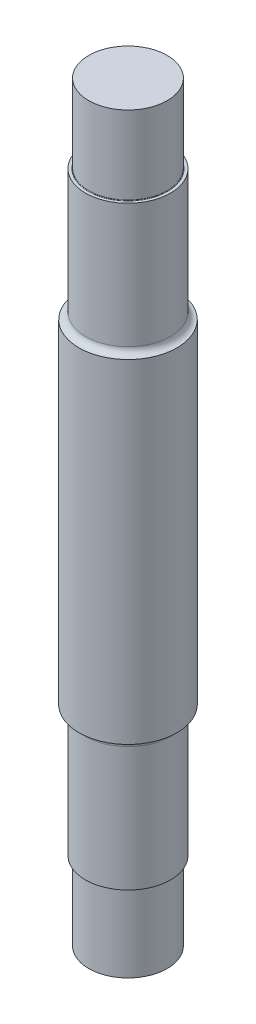
from build123d import *

# Parameters (mm, degrees)
CROQUIS14_R              = 30
SALIENTE_EXTRUIR10_DEPTH = 60
CROQUIS15_R              = 32.5
SALIENTE_EXTRUIR11_DEPTH = 100
CROQUIS16_R              = 37.5
SALIENTE_EXTRUIR12_DEPTH = 255
CROQUIS17_R              = 32.5
SALIENTE_EXTRUIR13_DEPTH = 100
CROQUIS18_R              = 30
SALIENTE_EXTRUIR14_DEPTH = 60
CORTAR_EXTRUIR5_DEPTH    = 16
REDONDEO9_R              = 5
REDONDEO10_R             = 0.4
REDONDEO11_R             = 5
REDONDEO12_R             = 0.4


with BuildPart() as part:
    # Croquis14 → Saliente-Extruir10 (new body)
    with BuildSketch(Plane(origin=(0, 0, 0), x_dir=(1, 0, 0), z_dir=(0, 1, 0))):
        with Locations(Location((0, 0, 0), (0, 0, 270))):
            Circle(CROQUIS14_R)
    extrude(amount=SALIENTE_EXTRUIR10_DEPTH)

    # Croquis15 → Saliente-Extruir11 (add)
    with BuildSketch(Plane(origin=(0, 60, 0), x_dir=(1, 0, 0), z_dir=(0, 1, 0))):
        with Locations(Location((0, 0, 0), (0, 0, 270))):
            Circle(CROQUIS15_R)
    extrude(amount=SALIENTE_EXTRUIR11_DEPTH)

    # Croquis16 → Saliente-Extruir12 (add)
    with BuildSketch(Plane(origin=(0, 160, 0), x_dir=(1, 0, 0), z_dir=(0, 1, 0))):
        with Locations(Location((0, 0, 0), (0, 0, 270))):
            Circle(CROQUIS16_R)
    extrude(amount=SALIENTE_EXTRUIR12_DEPTH)

    # Croquis17 → Saliente-Extruir13 (add)
    with BuildSketch(Plane(origin=(0, 415, 0), x_dir=(1, 0, 0), z_dir=(0, 1, 0))):
        with Locations(Location((0, 0, 0), (0, 0, 270))):
            Circle(CROQUIS17_R)
    extrude(amount=SALIENTE_EXTRUIR13_DEPTH)

    # Croquis18 → Saliente-Extruir14 (add)
    with BuildSketch(Plane(origin=(0, 515, 0), x_dir=(1, 0, 0), z_dir=(0, 1, 0))):
        with Locations(Location((0, 0, 0), (0, 0, 270))):
            Circle(CROQUIS18_R)
    extrude(amount=SALIENTE_EXTRUIR14_DEPTH)

    # Croquis19 → Cortar-Extruir5 (cut)
    with BuildSketch(Plane.XY.offset(-36)):
        with BuildLine():
            Line((-7.631790287, 8), (-7.631790287, 52))
            ThreePointArc((-7.631790287, 52), (0, 59.631790287), (7.631790287, 52))
            Line((7.631790287, 52), (7.631790287, 8))
            ThreePointArc((7.631790287, 8), (0, 0.368209713), (-7.631790287, 8))
        make_face()
        with BuildLine():
            Line((-7.631790287, 567), (-7.631790287, 523))
            ThreePointArc((-7.631790287, 523), (0, 515.368209713), (7.631790287, 523))
            Line((7.631790287, 523), (7.631790287, 567))
            ThreePointArc((7.631790287, 567), (0, 574.631790287), (-7.631790287, 567))
        make_face()
    extrude(amount=CORTAR_EXTRUIR5_DEPTH, mode=Mode.SUBTRACT)

    # Redondeo9
    redondeo9_edges = [part.edges().sort_by_distance(p)[0] for p in [
        (0, 415, -32.5),
    ]]
    fillet(redondeo9_edges, radius=REDONDEO9_R - 0.0001)  # a hair under: the kernel refuses the full size

    # Redondeo10
    redondeo10_edges = [part.edges().sort_by_distance(p)[0] for p in [
        (0, 515, -30),
    ]]
    fillet(redondeo10_edges, radius=REDONDEO10_R)

    # Redondeo11
    redondeo11_edges = [part.edges().sort_by_distance(p)[0] for p in [
        (0, 160, -32.5),
    ]]
    fillet(redondeo11_edges, radius=REDONDEO11_R - 0.0001)  # a hair under: the kernel refuses the full size

    # Redondeo12
    redondeo12_edges = [part.edges().sort_by_distance(p)[0] for p in [
        (0, 60, -30),
    ]]
    fillet(redondeo12_edges, radius=REDONDEO12_R)


solid = part.part
